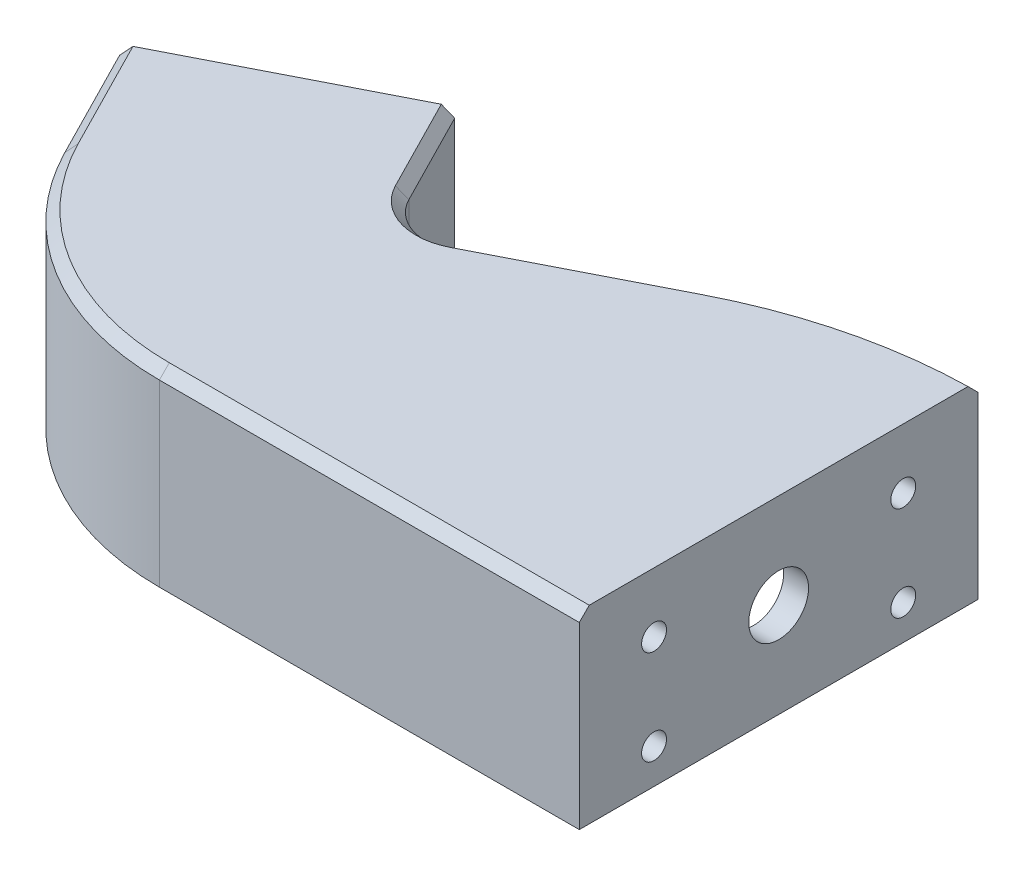
from build123d import *

# Parameters (mm, degrees)
ESTRUSIONE_ESTRUSIONE1_DEPTH = 5
ESTRUSIONE_SOTTILE1_START    = -33
ESTRUSIONE_SOTTILE1_DEPTH    = 33
RACCORDO1_R                  = 100
SMUSSO1_SIZE                 = 2
TAGLIO_ESTRUSIONE1_DEPTH     = 10
SCHIZZO3_R                   = 2.5
TAGLIO_ESTRUSIONE2_DEPTH     = 10
SCHIZZO3_4_R                 = 6
TAGLIO_ESTRUSIONE3_DEPTH     = 161


with BuildPart() as part:
    # Schizzo1 → Estrusione-Estrusione1 (new body)
    with BuildSketch(Plane(origin=(0, 0, 0), x_dir=(1, 0, 0), z_dir=(0, 1, 0))):
        with BuildLine():
            Line((0, -80), (0, 0))
            Line((0, 0), (-22.105704403, 0))
            Line((-22.105704403, 0), (-77.105704403, -28.023899722))
            ThreePointArc((-77.105704403, -28.023899722), (-84.735779344, -28.624399643), (-90.555674642, -23.653739478))
            Line((-90.555674642, -23.653739478), (-100.121590311, -4.879572892))
            Line((-100.121590311, -4.879572892), (-144.67191652, -27.579097879))
            Line((-144.67191652, -27.579097879), (-133.263448287, -49.969477486))
            ThreePointArc((-133.263448287, -49.969477486), (-112.995510516, -71.895209039), (-84.258089456, -80))
            Line((-84.258089456, -80), (0, -80))
        make_face()
    extrude(amount=ESTRUSIONE_ESTRUSIONE1_DEPTH)

    # Schizzo1<3> → Estrusione-Sottile1 (add)
    with BuildSketch(Plane(origin=(0, 0, 0), x_dir=(1, 0, 0), z_dir=(0, 1, 0)).offset(ESTRUSIONE_SOTTILE1_START)):
        with BuildLine():
            Line((-90.555674642, -23.653739478), (-100.121590311, -4.879572892))
            Line((-100.121590311, -4.879572892), (-144.67191652, -27.579097879))
            Line((-144.67191652, -27.579097879), (-133.263448287, -49.969477486))
            ThreePointArc((-133.263448287, -49.969477486), (-112.995510516, -71.895209039), (-84.258089456, -80))
            Line((-84.258089456, -80), (0, -80))
            Line((0, -80), (0, 0))
            Line((0, 0), (-22.105704403, 0))
            Line((-22.105704403, 0), (-77.105704403, -28.023899722))
            ThreePointArc((-77.105704403, -28.023899722), (-84.735779344, -28.624399643), (-90.555674642, -23.653739478))
        make_face()
        with BuildLine():
            Line((-95.010707263, -25.923691976), (-102.306670433, -11.604558011))
            Line((-102.306670433, -11.604558011), (-137.946931401, -29.764178001))
            Line((-137.946931401, -29.764178001), (-128.808415666, -47.699524987))
            ThreePointArc((-128.808415666, -47.699524987), (-110.383017692, -67.632008218), (-84.258089456, -75))
            Line((-84.258089456, -75), (-5, -75))
            Line((-5, -75), (-5, -5))
            Line((-5, -5), (-20.905310607, -5))
            Line((-20.905310607, -5), (-74.835751904, -32.478932343))
            ThreePointArc((-74.835751904, -32.478932343), (-86.280864316, -33.379682225), (-95.010707263, -25.923691976))
        make_face(mode=Mode.SUBTRACT)
    extrude(amount=ESTRUSIONE_SOTTILE1_DEPTH)

    # Raccordo1
    # the kernel refuses this fillet: 100 mm, written as the material it takes off along each edge
    with BuildSketch(Plane(origin=(-22.105704403, -92.916153629, 0), x_dir=(-0.8910065241883712, 0, 0.4539904997395403), z_dir=(0, 1, 0))) as raccordo1_piece_1:
        with BuildLine():
            CenterArc((23.966461452, 100), RACCORDO1_R, 244.111076085, 25.888923915)
            Line((-19.696326845, 10.035779789), (-20.569582611, 8.236495385))
            ThreePointArc((-20.569582611, 8.236495385), (-10.756144422, 3.235876846), (-0.907980999, -1.782013048))
            Line((-0.907980999, -1.782013048), (0, -2))
            Line((0, -2), (23.966461452, -2))
            Line((23.966461452, -2), (23.966461452, 0))
        make_face()
    extrude(amount=157.832307258, mode=Mode.SUBTRACT)

    # Smusso1
    smusso1_edges = [part.edges().sort_by_distance(p)[0] for p in [
        (-84.735779344, 5, 28.624399643),
        (-95.338632476, 5, 14.266656185),
        (-138.967682403, 5, 38.774287682),
        (-112.995510516, 5, 71.895209039),
        (-42.129044728, 5, 80),
        (-60.28284116, 5, 19.452222767),
        (-22.347158994, 5, 2.975121197),
    ]]
    chamfer(smusso1_edges, length=SMUSSO1_SIZE)

    # Schizzo2 → Taglio-Estrusione1 (cut)
    with BuildSketch(Plane(origin=(-18.661969348, 0, -36.626177095), x_dir=(-0.8910065241883686, 0, 0.4539904997395456), z_dir=(-0.4539904997395456, 0, -0.8910065241883686))):
        with BuildLine():
            Line((104.424269915, -10.991811), (108.424269915, -10.991811))
            ThreePointArc((108.424269915, -10.991811), (110.924269915, -13.491811), (108.424269915, -15.991811))
            Line((108.424269915, -15.991811), (104.424269915, -15.991811))
            ThreePointArc((104.424269915, -15.991811), (101.924269915, -13.491811), (104.424269915, -10.991811))
        make_face()
        with BuildLine():
            Line((124.424269915, -10.991811), (128.424269915, -10.991811))
            ThreePointArc((128.424269915, -10.991811), (130.924269915, -13.491811), (128.424269915, -15.991811))
            Line((128.424269915, -15.991811), (124.424269915, -15.991811))
            ThreePointArc((124.424269915, -15.991811), (121.924269915, -13.491811), (124.424269915, -10.991811))
        make_face()
    extrude(amount=-TAGLIO_ESTRUSIONE1_DEPTH, mode=Mode.SUBTRACT)

    # Schizzo3 → Taglio-Estrusione2 (cut)
    with BuildSketch(Plane(origin=(0, 0, 0), x_dir=(0, 0, -1), z_dir=(1, 0, 0))):
        with Locations((-65, -26)):
            Circle(SCHIZZO3_R)
        with Locations((-65, -7)):
            Circle(SCHIZZO3_R)
        with Locations((-15, -7)):
            Circle(SCHIZZO3_R)
        with Locations((-15, -26)):
            Circle(SCHIZZO3_R)
    extrude(amount=-TAGLIO_ESTRUSIONE2_DEPTH, mode=Mode.SUBTRACT)

    # Schizzo3<4> → Taglio-Estrusione3 (cut)
    with BuildSketch(Plane(origin=(0, 0, 0), x_dir=(0, 0, -1), z_dir=(1, 0, 0))):
        with Locations((-40, -14)):
            Circle(SCHIZZO3_4_R)
    extrude(amount=-TAGLIO_ESTRUSIONE3_DEPTH, mode=Mode.SUBTRACT)


solid = part.part
